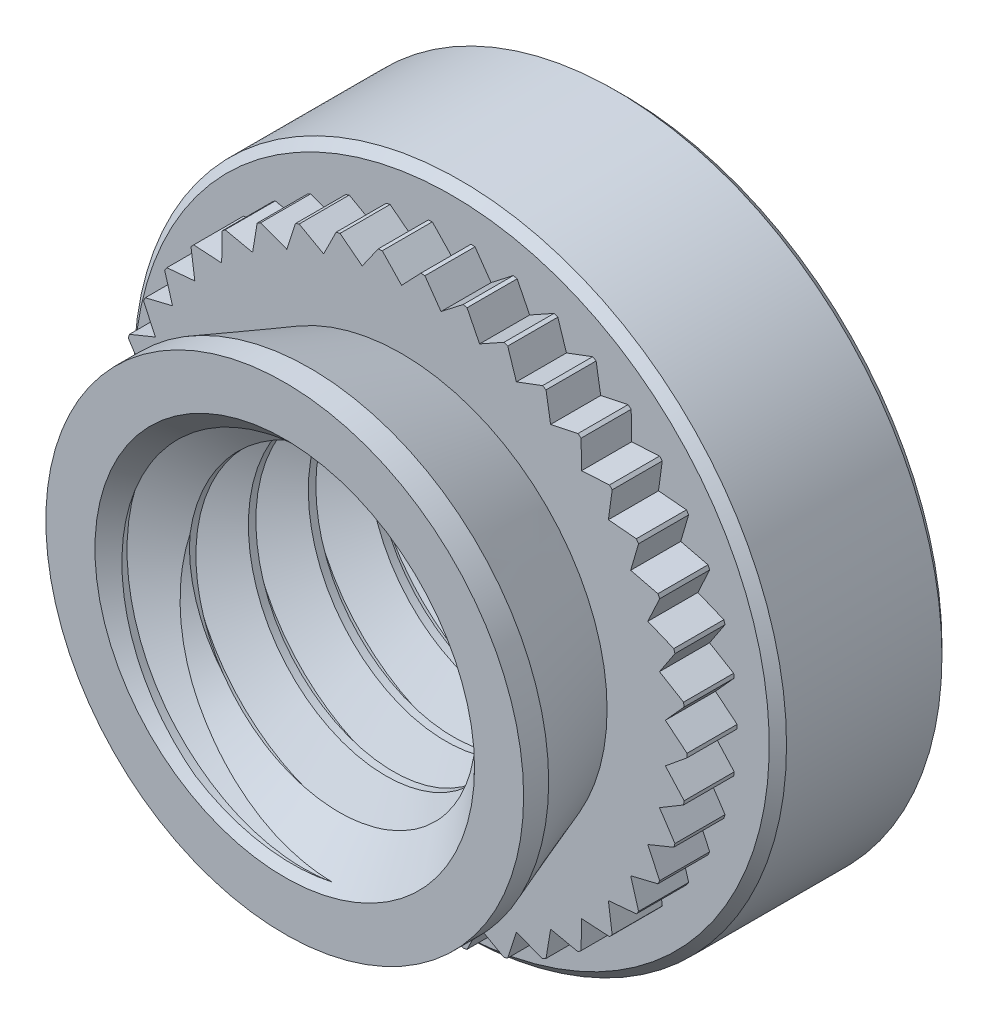
from build123d import *

# Parameters (mm, degrees)
CHAMFER1_SIZE           = 0.1143
SWEEP1_PITCH            = 0.79375
SWEEP1_HEIGHT           = 5.28955
SWEEP1_RADIUS           = 2.413
SWEEP1_START_ANGLE      = 90
CUT_EXTRUDE4_DEPTH      = 7.833256395
CUT_EXTRUDE4_DEPTH_BACK = 7.833256395
SKETCH10_W              = 3.175
SKETCH10_H              = 6.3246
SKETCH10_H_2            = 8.636
SKETCH12_R              = 2.51221875
CUT_EXTRUDE5_DEPTH      = 2.2479
CUT_EXTRUDE5_DRAFT      = -34
SKETCH13_R              = 2.51221875
CUT_EXTRUDE6_DEPTH      = 2.2479
CUT_EXTRUDE6_DRAFT      = -44
CUT_EXTRUDE1_DEPTH      = 0.66294
CIRPATTERN2_COUNT       = 42


with BuildPart() as part:
    # Sketch3 → Revolve1 (revolve)
    with BuildSketch(Plane(origin=(0, 0, 0), x_dir=(0, 0, -1), z_dir=(1, 0, 0)), mode=Mode.PRIVATE) as revolve1_sk:
        Polygon((-2.2479, 2.413), (2.2479, 2.413), (2.2479, 4.318), (-0.0381, 4.318), (-0.0381, 3.77825), (-0.70104, 3.77825), (-0.70104, 2.719934217), (-1.91643, 3.1623), (-2.2479, 3.1623), align=None)
    revolve(revolve1_sk.sketch.rotate(Axis((0, 0, 2.2479), (0, 0, -1)), 90), axis=Axis((0, 0, 2.2479), (0, 0, -1)))

    # Chamfer1
    chamfer1_edges = [part.edges().sort_by_distance(p)[0] for p in [
        (-4.318, 0, 0.0381),
        (-4.318, 0, -2.2479),
    ]]
    chamfer(chamfer1_edges, length=CHAMFER1_SIZE)

    # Sweep1: sweep along a helix
    with BuildLine() as sweep1_path:
        add(Helix(SWEEP1_PITCH, SWEEP1_HEIGHT, SWEEP1_RADIUS, center=(0, 0, -2.2479), direction=(0, 0, 1), mode=Mode.PRIVATE).rotate(Axis((0, 0, -2.2479), (0, 0, 1)), SWEEP1_START_ANGLE))
    # Sketch6 → Sweep1 (sweep)
    with BuildSketch(Plane(origin=(0, 0, 0), x_dir=(0, 0, -1), z_dir=(1, 0, 0))):
        Polygon((2.223095312, 2.455962979), (2.967235937, 2.455962979), (2.644775, 1.897444252), (2.54555625, 1.897444252), align=None)
    sweep(path=sweep1_path.line, is_frenet=True)

    # Sketch10 → Cut-Extrude4 (cut, two sides: drawn at the far end of the back side and taken through both)
    with BuildSketch(Plane(origin=(0, 0, 0), x_dir=(0, 0, -1), z_dir=(1, 0, 0)).offset(-CUT_EXTRUDE4_DEPTH_BACK)):
        with Locations((-3.8354, 0)):
            Rectangle(SKETCH10_W, SKETCH10_H)
        with Locations((3.8354, 0)):
            Rectangle(SKETCH10_W, SKETCH10_H_2)
    extrude(amount=CUT_EXTRUDE4_DEPTH + CUT_EXTRUDE4_DEPTH_BACK, mode=Mode.SUBTRACT)


with BuildPart() as cut_extrude5_tool:
    # Sketch12 → Cut-Extrude5 (with draft: the straight prism first)
    with BuildSketch(Plane(origin=(0, 0, -2.2479), x_dir=(-1, 0, 0), z_dir=(0, 0, -1))):
        Circle(SKETCH12_R)
    extrude(amount=-CUT_EXTRUDE5_DEPTH)
    # Cut-Extrude5: the draft: its side faces are tilted about the plane it starts from
    cut_extrude5_sides = [cut_extrude5_tool.faces().sort_by_distance(p)[0] for p in [
        (2.51221875, 0, -1.12395),
    ]]
    draft(cut_extrude5_sides, Plane(origin=(0, 0, -2.2479), x_dir=(-1, 0, 0), z_dir=(0, 0, -1)), CUT_EXTRUDE5_DRAFT)


with BuildPart() as part_1:
    add(part.part)

    # Cut-Extrude5: cut by cut_extrude5_tool
    add(cut_extrude5_tool.part, mode=Mode.SUBTRACT)


with BuildPart() as cut_extrude6_tool:
    # Sketch13 → Cut-Extrude6 (with draft: the straight prism first)
    with BuildSketch(Plane.XY.offset(2.2479)):
        Circle(SKETCH13_R)
    extrude(amount=-CUT_EXTRUDE6_DEPTH)
    # Cut-Extrude6: the draft: its side faces are tilted about the plane it starts from
    cut_extrude6_sides = [cut_extrude6_tool.faces().sort_by_distance(p)[0] for p in [
        (-2.51221875, 0, 1.12395),
    ]]
    draft(cut_extrude6_sides, Plane.XY.offset(2.2479), CUT_EXTRUDE6_DRAFT)


with BuildPart() as part_2:
    add(part_1.part)

    # Cut-Extrude6: cut by cut_extrude6_tool
    add(cut_extrude6_tool.part, mode=Mode.SUBTRACT)

    # Sketch4 → Cut-Extrude1 (cut)
    with BuildSketch(Plane.XY.offset(0.0381)):
        Polygon((0, 3.5010725), (-0.2644775, 3.77825), (0.2644775, 3.77825), align=None)
    cut_extrude1 = extrude(amount=CUT_EXTRUDE1_DEPTH, mode=Mode.SUBTRACT)

    # CirPattern2: Cut-Extrude1 ×42 about axis
    cirpattern2_axis = Axis((0, 0, 0), (0, 0, 1))
    for i in range(1, CIRPATTERN2_COUNT):
        add(cut_extrude1.rotate(cirpattern2_axis, i * 360 / CIRPATTERN2_COUNT), mode=Mode.SUBTRACT)


solid = part_2.part
